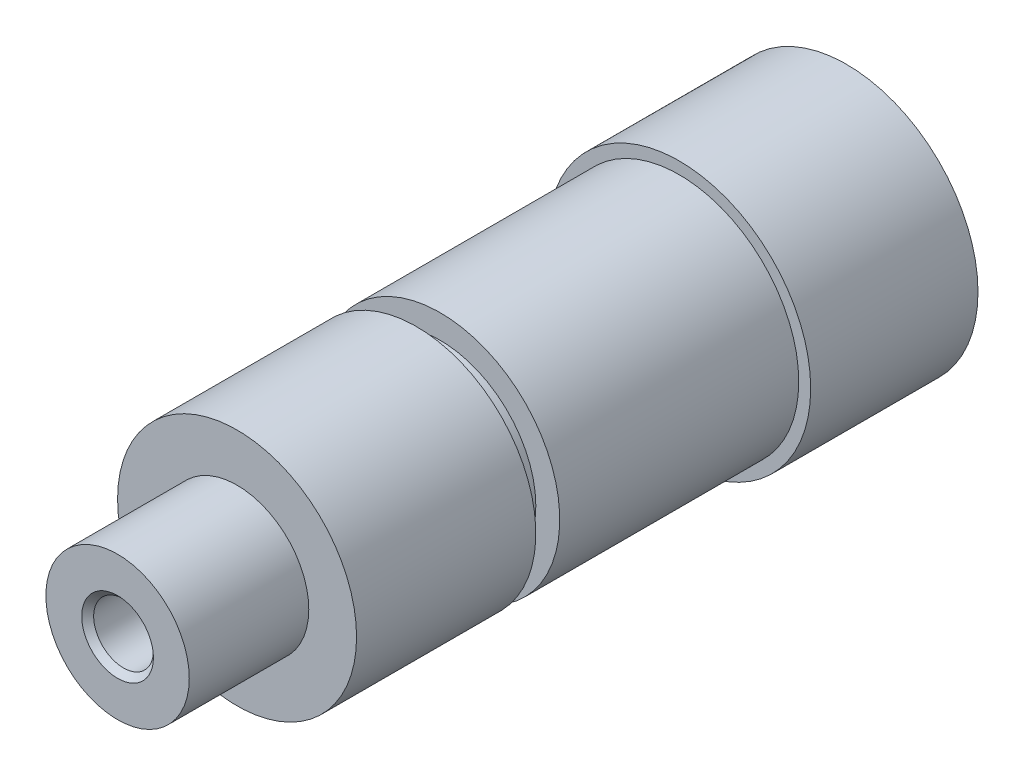
from build123d import *

# Parameters (mm, degrees)
ESQUISSE1_R                     = 11
BASE_EXTRUSION_DEPTH            = 14
ESQUISSE2_R                     = 10
BOSS_EXTRU_1_DEPTH              = 37
ESQUISSE3_W                     = 2
ESQUISSE3_H                     = 2
ESQUISSE4_R                     = 6
BOSS_EXTRU_2_DEPTH              = 10
TROU_TARAUD_M6X1_01_D           = 5
TROU_TARAUD_M6X1_01_DEPTH       = 19
TROU_TARAUD_M6X1_01_CSINK_D     = 6
TROU_TARAUD_M6X1_01_CSINK_ANGLE = 90
TROU_TARAUD_M6X1_01_TIP         = 1.502151548


with BuildPart() as part:
    # Esquisse1 → Base-Extrusion (new body)
    with BuildSketch(Plane.XY):
        Circle(ESQUISSE1_R)
    extrude(amount=BASE_EXTRUSION_DEPTH)

    # Esquisse2 → Boss.-Extru.1 (add)
    with BuildSketch(Plane.XY.offset(14)):
        Circle(ESQUISSE2_R)
    extrude(amount=BOSS_EXTRU_1_DEPTH)

    # Esquisse3 → Enlèvement de matière-Révolution1 (revolve, cut)
    with BuildSketch(Plane(origin=(0, 0, 0), x_dir=(1, 0, 0), z_dir=(0, 1, 0))):
        with Locations((9, -35)):
            Rectangle(ESQUISSE3_W, ESQUISSE3_H)
    revolve(axis=Axis((0, 0, 0), (0, 0, 1)), mode=Mode.SUBTRACT)

    # Esquisse4 → Boss.-Extru.2 (add)
    with BuildSketch(Plane.XY.offset(51)):
        Circle(ESQUISSE4_R)
    extrude(amount=BOSS_EXTRU_2_DEPTH)

    # Trou taraudé M6x1.01
    with Locations(Plane.XY.offset(61)):
        with Locations((0, 0)):
            CounterSinkHole(TROU_TARAUD_M6X1_01_D / 2, TROU_TARAUD_M6X1_01_CSINK_D / 2, depth=TROU_TARAUD_M6X1_01_DEPTH, counter_sink_angle=TROU_TARAUD_M6X1_01_CSINK_ANGLE)
            with Locations((0, 0, -(TROU_TARAUD_M6X1_01_DEPTH + TROU_TARAUD_M6X1_01_TIP / 2))):  # 118° drill point
                Cone(0, TROU_TARAUD_M6X1_01_D / 2, TROU_TARAUD_M6X1_01_TIP, mode=Mode.SUBTRACT)


solid = part.part
